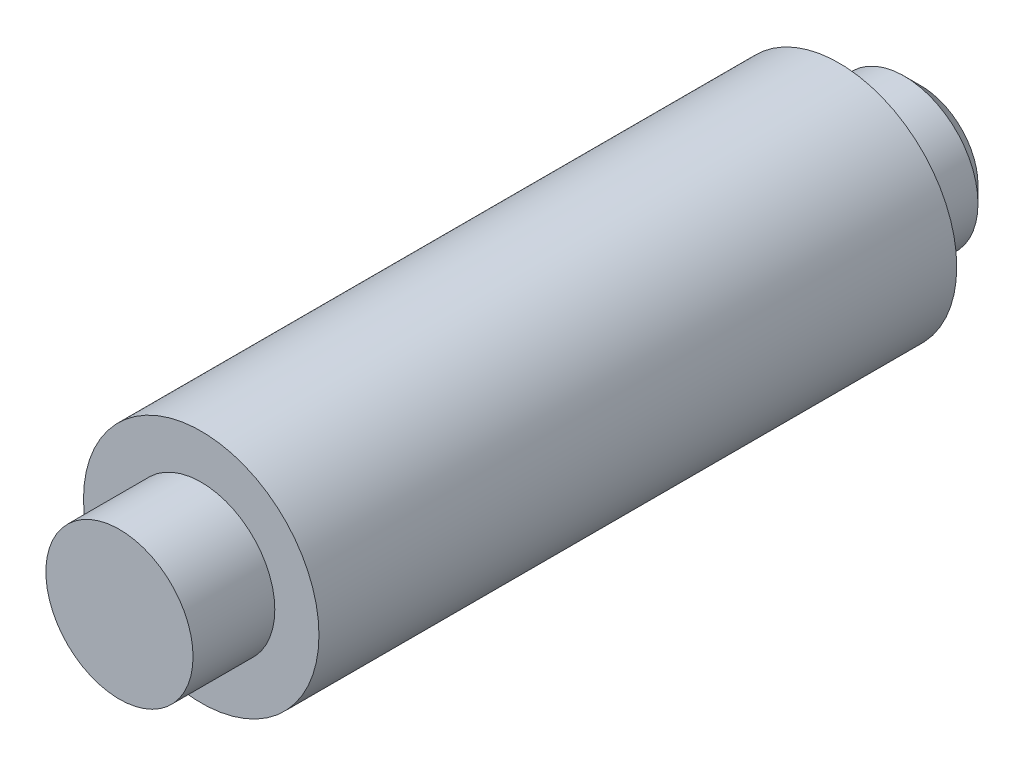
from build123d import *

# Parameters (mm, degrees)
SKETCH3_R           = 3.6
BOSS_EXTRUDE1_DEPTH = 19.5
SKETCH4_R           = 2.25
BOSS_EXTRUDE2_DEPTH = 2.5
BOSS_EXTRUDE3_START = 2.5
SKETCH5_R           = 2.25
BOSS_EXTRUDE3_DEPTH = 2.5
CHAMFER1_SIZE       = 0.5


with BuildPart() as part:
    # Sketch3 → Boss-Extrude1 (new body)
    with BuildSketch(Plane.XY):
        Circle(SKETCH3_R)
    extrude(amount=BOSS_EXTRUDE1_DEPTH)

    # Sketch4 → Boss-Extrude2 (add)
    with BuildSketch(Plane.XY):
        Circle(SKETCH4_R)
    extrude(amount=-BOSS_EXTRUDE2_DEPTH)

    # Sketch5 → Boss-Extrude3 (add)
    with BuildSketch(Plane.XY.offset(19.5).offset(BOSS_EXTRUDE3_START)):
        Circle(SKETCH5_R)
    extrude(amount=-BOSS_EXTRUDE3_DEPTH)

    # Chamfer1
    chamfer1_edges = [part.edges().sort_by_distance(p)[0] for p in [
        (-2.25, 0, -2.5),
    ]]
    chamfer(chamfer1_edges, length=CHAMFER1_SIZE)


solid = part.part
